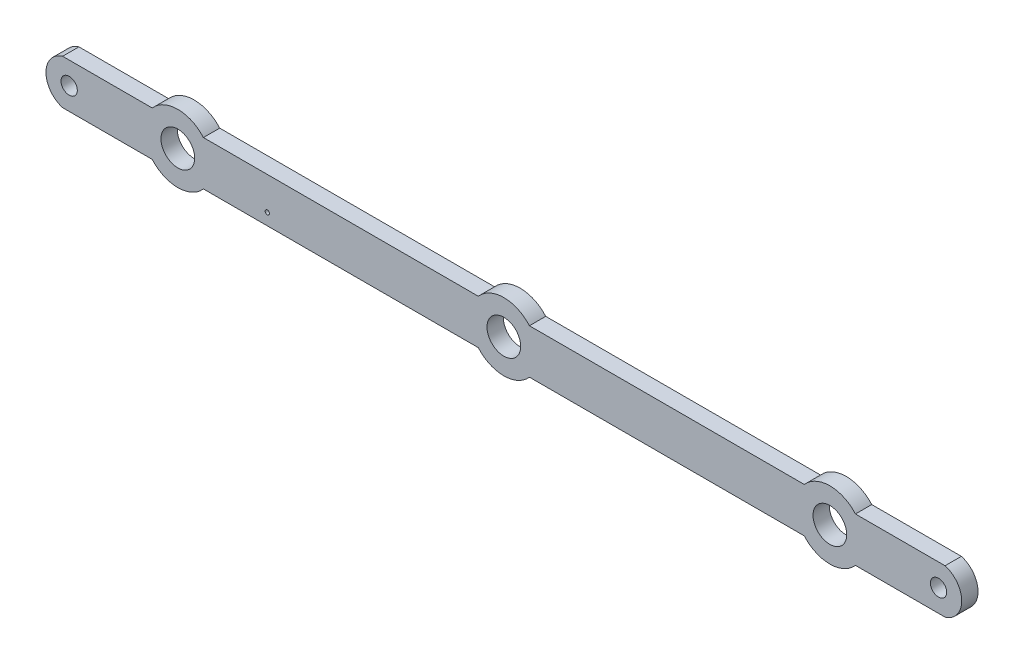
from build123d import *

# Parameters (mm, degrees)
SKETCH1_R           = 3.1
SKETCH1_R_2         = 1.5
SKETCH1_R_3         = 0.390297289
BOSS_EXTRUDE1_DEPTH = 3


with BuildPart() as part:
    # Sketch1 → Boss-Extrude1 (new body)
    with BuildSketch(Plane.XY):
        with BuildLine():
            Line((-81.201730293, 4.097407022), (-64.706257079, 4.097407022))
            ThreePointArc((-64.706257079, 4.097407022), (-60, 6.24), (-55.293742921, 4.097407022))
            Line((-55.293742921, 4.097407022), (-4.706257079, 4.097407022))
            ThreePointArc((-4.706257079, 4.097407022), (0, 6.24), (4.706257079, 4.097407022))
            Line((4.706257079, 4.097407022), (55.293742921, 4.097407022))
            ThreePointArc((55.293742921, 4.097407022), (60, 6.24), (64.706257079, 4.097407022))
            Line((64.706257079, 4.097407022), (81.201730293, 4.097407022))
            ThreePointArc((81.201730293, 4.097407022), (84.27, 0), (81.201730293, -4.097407022))
            Line((81.201730293, -4.097407022), (64.706257079, -4.097407022))
            ThreePointArc((64.706257079, -4.097407022), (60, -6.24), (55.293742921, -4.097407022))
            Line((55.293742921, -4.097407022), (4.706257079, -4.097407022))
            ThreePointArc((4.706257079, -4.097407022), (0, -6.24), (-4.706257079, -4.097407022))
            Line((-4.706257079, -4.097407022), (-55.293742921, -4.097407022))
            ThreePointArc((-55.293742921, -4.097407022), (-60, -6.24), (-64.706257079, -4.097407022))
            Line((-64.706257079, -4.097407022), (-81.201730293, -4.097407022))
            ThreePointArc((-81.201730293, -4.097407022), (-84.27, 0), (-81.201730293, 4.097407022))
        make_face()
        with Locations((-60, 0)):
            Circle(SKETCH1_R, mode=Mode.SUBTRACT)
        Circle(SKETCH1_R, mode=Mode.SUBTRACT)
        with Locations((60, 0)):
            Circle(SKETCH1_R, mode=Mode.SUBTRACT)
        with Locations((80, 0)):
            Circle(SKETCH1_R_2, mode=Mode.SUBTRACT)
        with Locations((-80, 0)):
            Circle(SKETCH1_R_2, mode=Mode.SUBTRACT)
        with Locations((-43.533553558, -1.94889321)):
            Circle(SKETCH1_R_3, mode=Mode.SUBTRACT)
    extrude(amount=BOSS_EXTRUDE1_DEPTH)


solid = part.part
